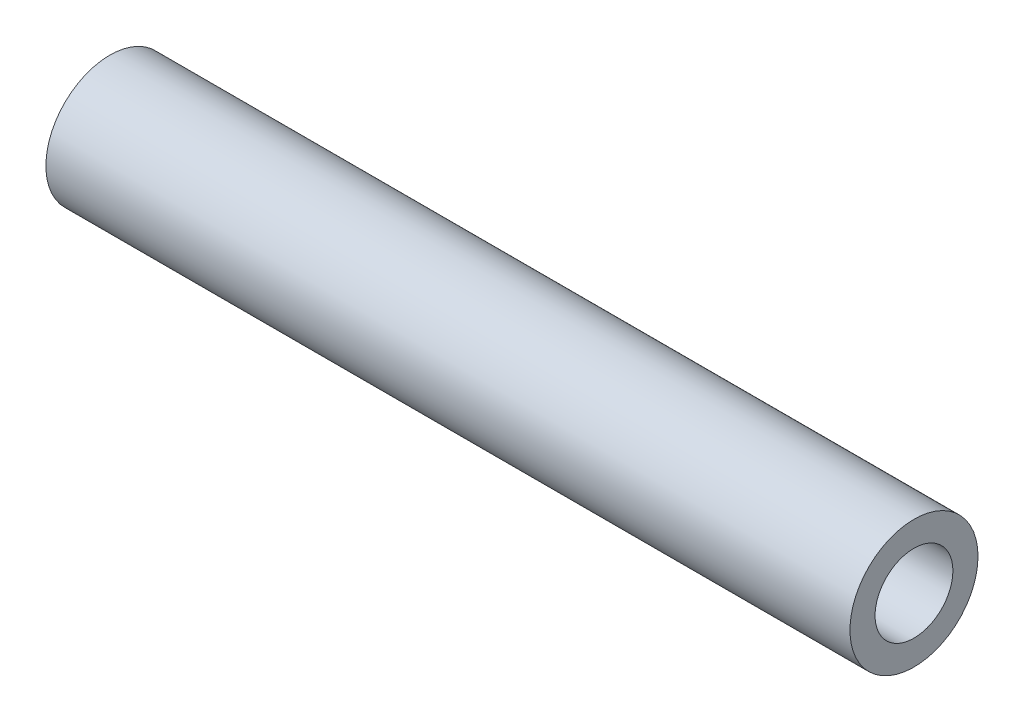
from build123d import *

# Parameters (mm, degrees)
SKETCH1_R           = 3.175
SKETCH1_R_2         = 1.9304
BOSS_EXTRUDE1_DEPTH = 19.939


with BuildPart() as part:
    # Sketch1 → Boss-Extrude1 (new, symmetric)
    with BuildSketch(Plane(origin=(0, 0, 0), x_dir=(0, 0, -1), z_dir=(1, 0, 0))):
        Circle(SKETCH1_R)
        Circle(SKETCH1_R_2, mode=Mode.SUBTRACT)
    extrude(amount=BOSS_EXTRUDE1_DEPTH, both=True)


solid = part.part
